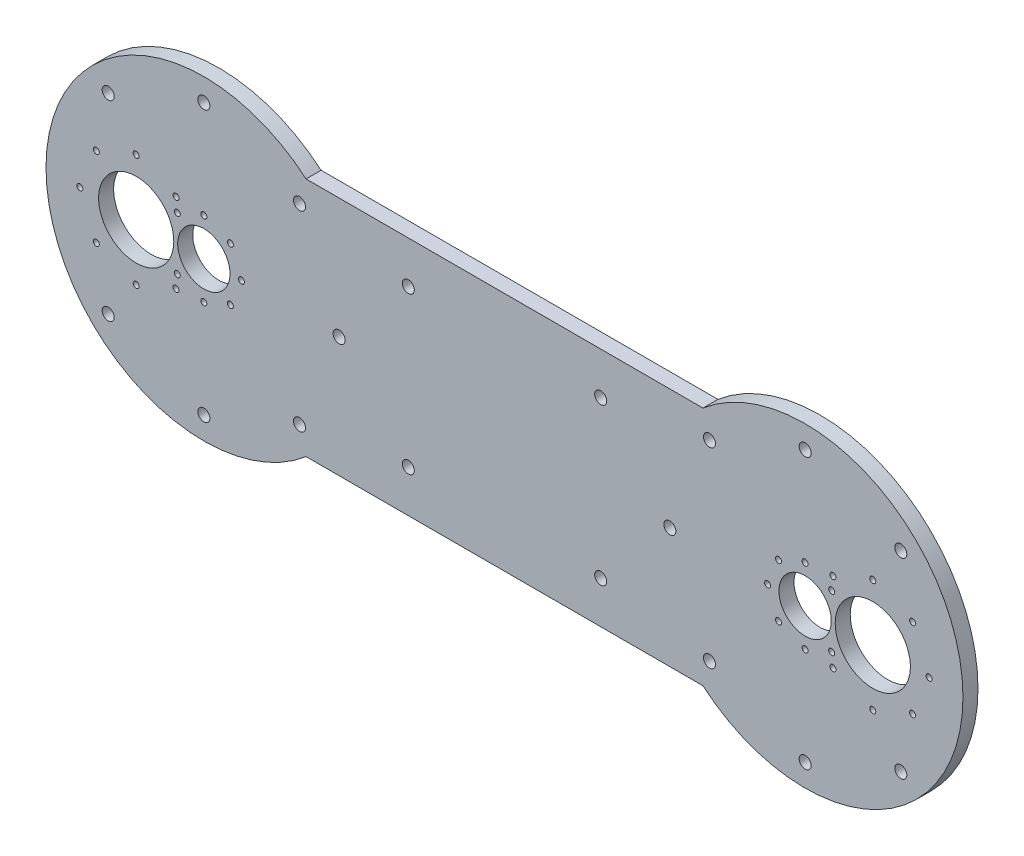
from build123d import *

# Parameters (mm, degrees)
SKETCH1_R           = 3.175
SKETCH1_R_2         = 2.54
BOSS_EXTRUDE1_DEPTH = 3.175
SKETCH2_R           = 11.049
SKETCH2_R_2         = 15.875
SKETCH2_R_3         = 1.27
CUT_EXTRUDE1_DEPTH  = 205.928972451
SKETCH3_R           = 2.54
CUT_EXTRUDE2_DEPTH  = 205.928972451


with BuildPart() as part:
    # Sketch1 → Boss-Extrude1 (new, symmetric)
    with BuildSketch(Plane.XY):
        with BuildLine():
            Line((-83.815331135, 50.8), (83.815331135, 50.8))
            ThreePointArc((83.815331135, 50.8), (193.675, 0), (83.815331135, -50.8))
            Line((83.815331135, -50.8), (-83.815331135, -50.8))
            ThreePointArc((-83.815331135, -50.8), (-193.675, 0), (-83.815331135, 50.8))
        make_face()
        with Locations((-127, 0)):
            Circle(SKETCH1_R, mode=Mode.SUBTRACT)
        with Locations((127, 0)):
            Circle(SKETCH1_R, mode=Mode.SUBTRACT)
        with Locations((-127, 57.15)):
            Circle(SKETCH1_R_2, mode=Mode.SUBTRACT)
        with Locations((-86.588847455, 40.411152545)):
            Circle(SKETCH1_R_2, mode=Mode.SUBTRACT)
        with Locations((-69.85, 0)):
            Circle(SKETCH1_R_2, mode=Mode.SUBTRACT)
        with Locations((-86.588847455, -40.411152545)):
            Circle(SKETCH1_R_2, mode=Mode.SUBTRACT)
        with Locations((-127, -57.15)):
            Circle(SKETCH1_R_2, mode=Mode.SUBTRACT)
        with Locations((-167.411152545, -40.411152545)):
            Circle(SKETCH1_R_2, mode=Mode.SUBTRACT)
        with Locations((-167.411152545, 40.411152545)):
            Circle(SKETCH1_R_2, mode=Mode.SUBTRACT)
        with Locations((127, 57.15)):
            Circle(SKETCH1_R_2, mode=Mode.SUBTRACT)
        with Locations((167.411152545, 40.411152545)):
            Circle(SKETCH1_R_2, mode=Mode.SUBTRACT)
        with Locations((167.411152545, -40.411152545)):
            Circle(SKETCH1_R_2, mode=Mode.SUBTRACT)
        with Locations((127, -57.15)):
            Circle(SKETCH1_R_2, mode=Mode.SUBTRACT)
        with Locations((86.588847455, -40.411152545)):
            Circle(SKETCH1_R_2, mode=Mode.SUBTRACT)
        with Locations((69.85, 0)):
            Circle(SKETCH1_R_2, mode=Mode.SUBTRACT)
        with Locations((86.588847455, 40.411152545)):
            Circle(SKETCH1_R_2, mode=Mode.SUBTRACT)
    extrude(amount=BOSS_EXTRUDE1_DEPTH, both=True)

    # Sketch2 → Cut-Extrude1 (cut, through all)
    with BuildSketch(Plane.XY.offset(3.175)):
        with Locations((-127, 0)):
            Circle(SKETCH2_R)
        with Locations((-155.575, 0)):
            Circle(SKETCH2_R_2)
        with Locations((-155.575, 23.8125)):
            Circle(SKETCH2_R_3)
        with Locations((-138.737019773, 16.837980227)):
            Circle(SKETCH2_R_3)
        with Locations((-138.737019773, -16.837980227)):
            Circle(SKETCH2_R_3)
        with Locations((-155.575, -23.8125)):
            Circle(SKETCH2_R_3)
        with Locations((-172.412980227, -16.837980227)):
            Circle(SKETCH2_R_3)
        with Locations((-179.3875, 0)):
            Circle(SKETCH2_R_3)
        with Locations((-172.412980227, 16.837980227)):
            Circle(SKETCH2_R_3)
        with Locations((-127, 15.875)):
            Circle(SKETCH2_R_3)
        with Locations((-115.774679849, 11.225320151)):
            Circle(SKETCH2_R_3)
        with Locations((-111.125, 0)):
            Circle(SKETCH2_R_3)
        with Locations((-115.774679849, -11.225320151)):
            Circle(SKETCH2_R_3)
        with Locations((-127, -15.875)):
            Circle(SKETCH2_R_3)
        with Locations((-138.225320151, -11.225320151)):
            Circle(SKETCH2_R_3)
        with Locations((138.225320151, 11.225320151)):
            Circle(SKETCH2_R_3)
        with Locations((-138.225320151, 11.225320151)):
            Circle(SKETCH2_R_3)
        with Locations((138.225320151, -11.225320151)):
            Circle(SKETCH2_R_3)
        with Locations((127, -15.875)):
            Circle(SKETCH2_R_3)
        with Locations((115.774679849, -11.225320151)):
            Circle(SKETCH2_R_3)
        with Locations((111.125, 0)):
            Circle(SKETCH2_R_3)
        with Locations((115.774679849, 11.225320151)):
            Circle(SKETCH2_R_3)
        with Locations((127, 15.875)):
            Circle(SKETCH2_R_3)
        with Locations((172.412980227, 16.837980227)):
            Circle(SKETCH2_R_3)
        with Locations((179.3875, 0)):
            Circle(SKETCH2_R_3)
        with Locations((172.412980227, -16.837980227)):
            Circle(SKETCH2_R_3)
        with Locations((155.575, -23.8125)):
            Circle(SKETCH2_R_3)
        with Locations((138.737019773, -16.837980227)):
            Circle(SKETCH2_R_3)
        with Locations((138.737019773, 16.837980227)):
            Circle(SKETCH2_R_3)
        with Locations((155.575, 23.8125)):
            Circle(SKETCH2_R_3)
        with Locations((155.575, 0)):
            Circle(SKETCH2_R_2)
        with Locations((127, 0)):
            Circle(SKETCH2_R)
    extrude(amount=-CUT_EXTRUDE1_DEPTH, mode=Mode.SUBTRACT)

    # Sketch3 → Cut-Extrude2 (cut, through all)
    with BuildSketch(Plane.XY.offset(3.175)):
        with Locations((-40.64, 33.02)):
            Circle(SKETCH3_R)
        with Locations((40.64, 33.02)):
            Circle(SKETCH3_R)
        with Locations((40.64, -33.02)):
            Circle(SKETCH3_R)
        with Locations((-40.64, -33.02)):
            Circle(SKETCH3_R)
    extrude(amount=-CUT_EXTRUDE2_DEPTH, mode=Mode.SUBTRACT)


solid = part.part
